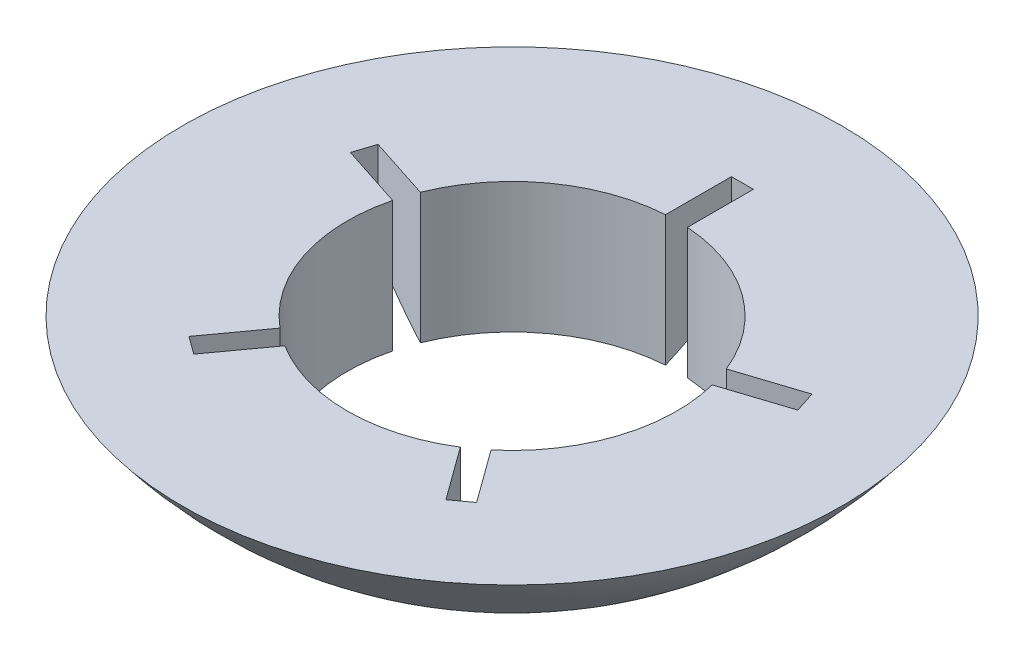
from build123d import *

# Parameters (mm, degrees)
TAGLIO_ESTRUSIONE3_DEPTH = 5.500000167


with BuildPart() as part:
    # Schizzo2 → Rivoluzione2 (revolve)
    with BuildSketch(Plane.XY):
        with BuildLine():
            Line((3, 0), (0, 0))
            Line((0, 0), (0, -1.5))
            ThreePointArc((0, -1.5), (1.677059909, -1.104119819), (3, 0))
        make_face()
    revolve(axis=Axis((0, -1.5, 0), (0, 1, 0)))

    # Schizzo3 → Taglio-Estrusione3 (cut, through all)
    with BuildSketch(Plane(origin=(0, -1.5, 0), x_dir=(-1, 0, 0), z_dir=(0, -1, 0))):
        with BuildLine():
            Line((0.1, 2.096662955), (-0.1, 2.096662955))
            Line((-0.1, 2.096662955), (-0.1, 1.496662955))
            ThreePointArc((-0.1, 1.496662955), (-0.881677878, 1.213525492), (-1.392509356, 0.557599939))
            Line((-1.392509356, 0.557599939), (-1.98100003, 0.74881215))
            Line((-1.98100003, 0.74881215), (-2.042803429, 0.558600847))
            Line((-2.042803429, 0.558600847), (-1.454312755, 0.367388636))
            ThreePointArc((-1.454312755, 0.367388636), (-1.426584774, -0.463525492), (-0.960618112, -1.15204724))
            Line((-0.960618112, -1.15204724), (-1.309372877, -1.632066993))
            Line((-1.309372877, -1.632066993), (-1.147569478, -1.749624043))
            Line((-1.147569478, -1.749624043), (-0.798814713, -1.26960429))
            ThreePointArc((-0.798814713, -1.26960429), (0, -1.5), (0.798814713, -1.26960429))
            Line((0.798814713, -1.26960429), (1.147569478, -1.749624043))
            Line((1.147569478, -1.749624043), (1.309372877, -1.632066993))
            Line((1.309372877, -1.632066993), (0.960618112, -1.15204724))
            ThreePointArc((0.960618112, -1.15204724), (1.426584774, -0.463525492), (1.454312755, 0.367388636))
            Line((1.454312755, 0.367388636), (2.024738008, 0.552731036))
            Line((2.024738008, 0.552731036), (1.962934609, 0.742942339))
            Line((1.962934609, 0.742942339), (1.392509356, 0.557599939))
            ThreePointArc((1.392509356, 0.557599939), (0.881677878, 1.213525492), (0.1, 1.496662955))
            Line((0.1, 1.496662955), (0.1, 2.096662955))
        make_face()
    extrude(amount=-TAGLIO_ESTRUSIONE3_DEPTH, mode=Mode.SUBTRACT)


solid = part.part
